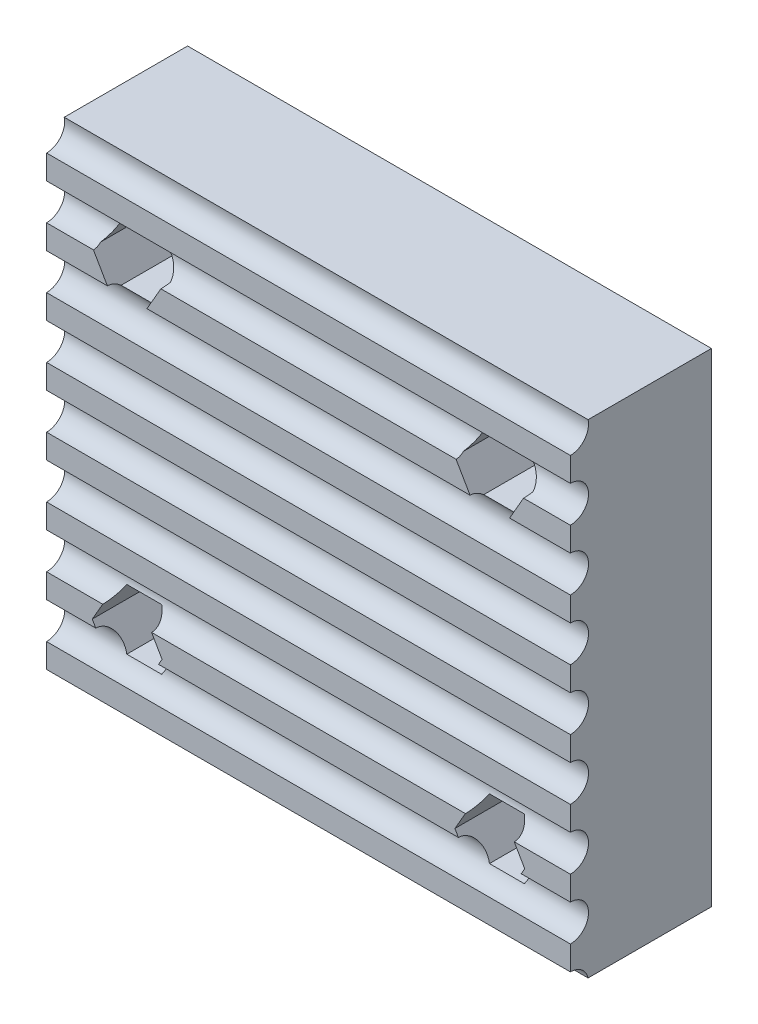
from build123d import *

# Parameters (mm, degrees)
SKETCH3_W           = 26
SKETCH3_H           = 24
BOSS_EXTRUDE2_DEPTH = 7
SKETCH7_R           = 0.9
CUT_EXTRUDE1_DEPTH  = 37.069377594


with BuildPart() as part:
    # Sketch3 → Boss-Extrude2 (new body)
    with BuildSketch(Plane.XY):
        with Locations((13, 12)):
            Rectangle(SKETCH3_W, SKETCH3_H)
        Polygon((22.866025404, 5.5), (23.732050808, 4), (22.866025404, 2.5), (21.133974596, 2.5), (20.267949192, 4), (21.133974596, 5.5), align=None, mode=Mode.SUBTRACT)
        Polygon((22.866025404, 21.5), (23.732050808, 20), (22.866025404, 18.5), (21.133974596, 18.5), (20.267949192, 20), (21.133974596, 21.5), align=None, mode=Mode.SUBTRACT)
        Polygon((5.732050808, 20), (4.866025404, 18.5), (3.133974596, 18.5), (2.267949192, 20), (3.133974596, 21.5), (4.866025404, 21.5), align=None, mode=Mode.SUBTRACT)
        Polygon((4.866025404, 5.5), (5.732050808, 4), (4.866025404, 2.5), (3.133974596, 2.5), (2.267949192, 4), (3.133974596, 5.5), align=None, mode=Mode.SUBTRACT)
    extrude(amount=BOSS_EXTRUDE2_DEPTH)

    # Sketch7 → Cut-Extrude1 (cut, through all)
    with BuildSketch(Plane(origin=(26, 0, 0), x_dir=(0, 0, -1), z_dir=(1, 0, 0))):
        with Locations((-7, 23.8)):
            Circle(SKETCH7_R)
        with Locations((-7, 20.8)):
            Circle(SKETCH7_R)
        with Locations((-7, 17.8)):
            Circle(SKETCH7_R)
        with Locations((-7, 14.8)):
            Circle(SKETCH7_R)
        with Locations((-7, 11.8)):
            Circle(SKETCH7_R)
        with Locations((-7, 8.8)):
            Circle(SKETCH7_R)
        with Locations((-7, 5.8)):
            Circle(SKETCH7_R)
        with Locations((-7, 2.8)):
            Circle(SKETCH7_R)
        with Locations((-7, -0.2)):
            Circle(SKETCH7_R)
    extrude(amount=-CUT_EXTRUDE1_DEPTH, mode=Mode.SUBTRACT)


solid = part.part
